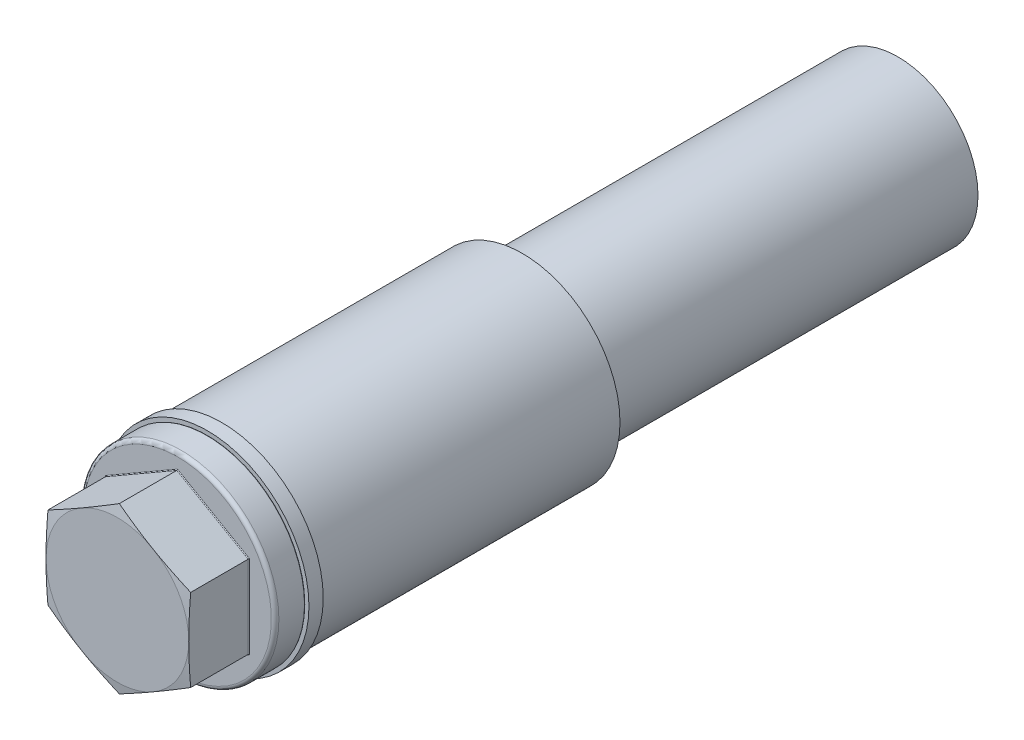
from build123d import *

# Parameters (mm, degrees)
BOSS_EXTRUDE1_DEPTH = 8
SKETCH3_OUTSIDE_W   = 226.316
SKETCH3_OUTSIDE_H   = 229.256
SKETCH3_OUTSIDE_R   = 9.5
CUT_EXTRUDE1_DEPTH  = 17.570556217
CUT_EXTRUDE1_DRAFT  = -80
SKETCH4_R           = 13
BOSS_EXTRUDE2_DEPTH = 4
FILLET1_R           = 0.5
FILLET2_R           = 0.1
CUT_SWEEP1_PITCH    = 1.814285714
SKETCH10_W          = 4
SKETCH10_H          = 1.9


with BuildPart() as part:
    # Sketch2 → Boss-Extrude1 (new body)
    with BuildSketch(Plane.XY):
        Polygon((0, -10.969655115), (9.5, -5.484827557), (9.5, 5.484827557), (0, 10.969655115), (-9.5, 5.484827557), (-9.5, -5.484827557), align=None)
    extrude(amount=-BOSS_EXTRUDE1_DEPTH)


with BuildPart() as cut_extrude1_tool:
    # Sketch3 outside → Cut-Extrude1 (with draft: the straight prism first)
    with BuildSketch(Plane.XY):
        Rectangle(SKETCH3_OUTSIDE_W, SKETCH3_OUTSIDE_H)
        Circle(SKETCH3_OUTSIDE_R, mode=Mode.SUBTRACT)
    extrude(amount=-CUT_EXTRUDE1_DEPTH)
    # Cut-Extrude1: the draft: its side faces are tilted about the plane it starts from
    cut_extrude1_sides = [cut_extrude1_tool.faces().sort_by_distance(p)[0] for p in [
        (0, -114.628, -8.785278108),
        (113.158, 0, -8.785278108),
        (0, 114.628, -8.785278108),
        (-113.158, 0, -8.785278108),
        (-9.5, 0, -8.785278108),
    ]]
    draft(cut_extrude1_sides, Plane.XY, CUT_EXTRUDE1_DRAFT)


with BuildPart() as part_1:
    add(part.part)

    # Cut-Extrude1: cut by cut_extrude1_tool
    add(cut_extrude1_tool.part, mode=Mode.SUBTRACT)

    # Sketch4 → Boss-Extrude2 (add)
    with BuildSketch(Plane(origin=(0, 0, -8), x_dir=(-1, 0, 0), z_dir=(0, 0, -1))):
        Circle(SKETCH4_R)
    extrude(amount=BOSS_EXTRUDE2_DEPTH)

    # Fillet1
    fillet1_edges = [part_1.edges().sort_by_distance(p)[0] for p in [
        (13, 0, -8),
    ]]
    fillet(fillet1_edges, radius=FILLET1_R)

    # Sketch5 → Revolve1 (revolve)
    with BuildSketch(Plane(origin=(0, 0, 0), x_dir=(0, 0, -1), z_dir=(1, 0, 0)), mode=Mode.PRIVATE) as revolve1_sk:
        Polygon((12, 10.969655115), (12, 0), (26, 0), (26, 9.039285714), (24.639285714, 10.4), (15.041071429, 10.4), (13.680357143, 9.039285714), (13, 9.039285714), align=None)
    revolve(revolve1_sk.sketch.rotate(Axis((0, 0, -12), (0, 0, -1)), 90), axis=Axis((0, 0, -12), (0, 0, -1)))

    # Fillet2
    fillet2_edges = [part_1.edges().sort_by_distance(p)[0] for p in [
        (9.5, 0, -8),
        (4.75, 8.227241336, -8),
        (-4.75, 8.227241336, -8),
        (-9.5, 0, -8),
        (-4.75, -8.227241336, -8),
        (13, 0, -12),
        (4.75, -8.227241336, -8),
    ]]
    fillet(fillet2_edges, radius=FILLET2_R)


with BuildPart() as body_2:
    # Split1: the piece on the far side of the plane
    add(part_1.part)
    split(bisect_by=Plane.XY.offset(-13), keep=Keep.BOTTOM)

    # Cut-Sweep1: the profile of Sketch7 screwed along a right-hand helix of 7.716535 turns, 10 arcs to a turn; built about Z, then put on its axis
    cut_sweep1_z = Axis((0, 0, 0), (0, 0, 1))
    cut_sweep1_corners = [(10.45, 0, 0.026028353), (10.45, 0, -1.613528353), (10.4, 0, -1.5875), (9.093046089, 0, -0.907142857), (9.093046089, 0, -0.680357143), (10.4, 0, 0)]
    with BuildLine(mode=Mode.PRIVATE) as cut_sweep1_profile:
        Line(cut_sweep1_corners[0], cut_sweep1_corners[1])
        Line(cut_sweep1_corners[1], cut_sweep1_corners[2])
        Line(cut_sweep1_corners[2], cut_sweep1_corners[3])
        Line(cut_sweep1_corners[3], cut_sweep1_corners[4])
        Line(cut_sweep1_corners[4], cut_sweep1_corners[5])
        Line(cut_sweep1_corners[5], cut_sweep1_corners[0])
    cut_sweep1_cap = Face(cut_sweep1_profile.wire())
    cut_sweep1_turn_angles = [0, 18, 36, 54, 72, 90, 108, 126, 144, 162, 180, 198, 216, 234, 252, 270, 288, 306, 324, 342, 360]
    cut_sweep1_turn_weights = [1, 0.9510565162951535, 1, 0.9510565162951535, 1, 0.9510565162951535, 1, 0.9510565162951535, 1, 0.9510565162951535, 1, 0.9510565162951535, 1, 0.9510565162951535, 1, 0.9510565162951535, 1, 0.9510565162951535, 1, 0.9510565162951535, 1]
    cut_sweep1_turn_rails = [Edge.make_bspline([Vector(p[0], p[1], 0).rotate(cut_sweep1_z, cut_sweep1_turn_angles[k]) / cut_sweep1_turn_weights[k] + Vector(0, 0, p[2] + CUT_SWEEP1_PITCH * cut_sweep1_turn_angles[k] / 360) for k in range(21)], [0, 0, 0, 1, 1, 2, 2, 3, 3, 4, 4, 5, 5, 6, 6, 7, 7, 8, 8, 9, 9, 10, 10, 10], 2, cut_sweep1_turn_weights) for p in cut_sweep1_corners]
    cut_sweep1_turn_sides = [Face.make_surface_from_curves(cut_sweep1_turn_rails[p[0]], cut_sweep1_turn_rails[p[1]]) for p in [(0, 1), (1, 2), (2, 3), (3, 4), (4, 5), (5, 0)]]
    cut_sweep1_turn = Solid(Shell([*cut_sweep1_turn_sides, cut_sweep1_cap, cut_sweep1_cap.rotate(cut_sweep1_z, 360).moved(Location((0, 0, CUT_SWEEP1_PITCH * 360 / 360)))]))
    cut_sweep1_last_angles = [2520, 2538, 2556, 2574, 2592, 2610, 2628, 2646, 2664, 2682, 2700, 2718, 2736, 2754, 2772, 2774.976377953, 2777.952755906]
    cut_sweep1_last_weights = [1, 0.9510565162951535, 1, 0.9510565162951535, 1, 0.9510565162951535, 1, 0.9510565162951535, 1, 0.9510565162951535, 1, 0.9510565162951535, 1, 0.9510565162951535, 1, 0.9986510270809072, 1]
    cut_sweep1_last_rails = [Edge.make_bspline([Vector(p[0], p[1], 0).rotate(cut_sweep1_z, cut_sweep1_last_angles[k]) / cut_sweep1_last_weights[k] + Vector(0, 0, p[2] + CUT_SWEEP1_PITCH * cut_sweep1_last_angles[k] / 360) for k in range(17)], [0, 0, 0, 1, 1, 2, 2, 3, 3, 4, 4, 5, 5, 6, 6, 7, 7, 8, 8, 8], 2, cut_sweep1_last_weights) for p in cut_sweep1_corners]
    cut_sweep1_last_sides = [Face.make_surface_from_curves(cut_sweep1_last_rails[p[0]], cut_sweep1_last_rails[p[1]]) for p in [(0, 1), (1, 2), (2, 3), (3, 4), (4, 5), (5, 0)]]
    cut_sweep1_last = Solid(Shell([*cut_sweep1_last_sides, cut_sweep1_cap.rotate(cut_sweep1_z, 2520).moved(Location((0, 0, CUT_SWEEP1_PITCH * 2520 / 360))), cut_sweep1_cap.rotate(cut_sweep1_z, 2777.952755906).moved(Location((0, 0, CUT_SWEEP1_PITCH * 2777.952755906 / 360)))]))
    cut_sweep1_each = [*[cut_sweep1_turn.moved(Location((0, 0, CUT_SWEEP1_PITCH * i))) for i in range(7)], cut_sweep1_last]
    add(Plane(origin=(0, 0, -26), x_dir=(0, 1, 0), z_dir=(0, 0, 1)) * Compound([cut_sweep1_each[i] for i in range(0, 8, 2)]), mode=Mode.SUBTRACT)
    add(Plane(origin=(0, 0, -26), x_dir=(0, 1, 0), z_dir=(0, 0, 1)) * Compound([cut_sweep1_each[i] for i in range(1, 8, 2)]), mode=Mode.SUBTRACT)


with BuildPart() as part_2:
    add(part_1.part)

    # Split1
    split(bisect_by=Plane.XY.offset(-13), keep=Keep.TOP)

    # Combine1: union body 2
    add(body_2.part)

    # Sketch9 → Thermometer case (revolve)
    with BuildSketch(Plane(origin=(0, 0, 0), x_dir=(0, 0, -1), z_dir=(1, 0, 0)), mode=Mode.PRIVATE) as thermometer_case_sk:
        Polygon((13.9, 9.3155), (43.9, 9.3155), (43.9, 7.85), (101.131, 7.85), (101.131, 0), (103.9, 0), (103.9, 10.65), (53.9, 10.65), (53.9, 13), (13.9, 13), align=None)
    revolve(thermometer_case_sk.sketch.rotate(Axis((0, 0, 0), (0, 0, -1)), 90), axis=Axis((0, 0, 0), (0, 0, -1)))

    # Sketch10 → Gasket (revolve)
    with BuildSketch(Plane(origin=(0, 0, 0), x_dir=(1, 0, 0), z_dir=(0, 1, 0)), mode=Mode.PRIVATE) as gasket_sk:
        with Locations((-11.5, 12.95)):
            Rectangle(SKETCH10_W, SKETCH10_H)
    revolve(gasket_sk.sketch.rotate(Axis((0, 0, -0.259139849), (0, 0, -1)), 180), axis=Axis((0, 0, -0.259139849), (0, 0, -1)))


solid = part_2.part
